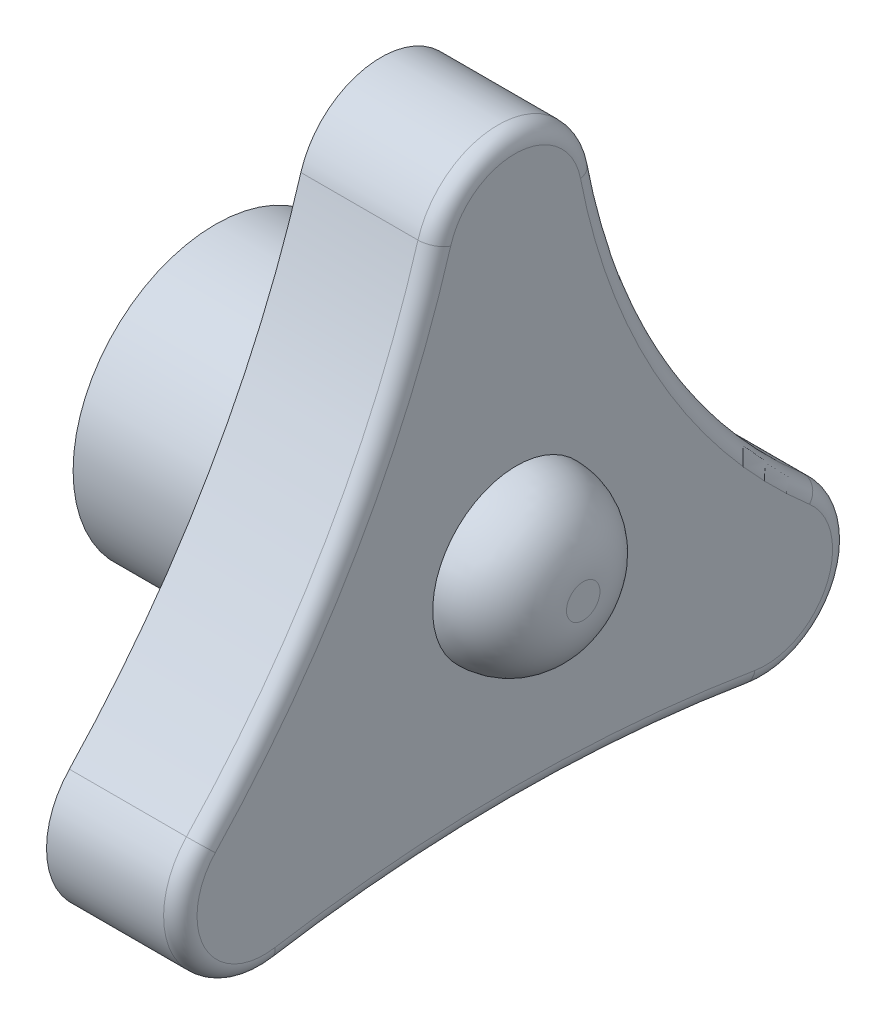
from build123d import *

# Parameters (mm, degrees)
BOSS_EXTRUDE1_DEPTH = 4
FILLET1_R           = 0.5
SHELL2_T            = -1
SKETCH2_R           = 4.25
SKETCH2_R_2         = 2.25
BOSS_EXTRUDE2_DEPTH = 8
SKETCH3_R           = 2.5
BOSS_EXTRUDE3_DEPTH = 2
FILLET2_R           = 2


with BuildPart() as part:
    # Sketch1 → Boss-Extrude1 (new body)
    with BuildSketch(Plane(origin=(0, 0, 0), x_dir=(0, 0, -1), z_dir=(1, 0, 0))):
        with BuildLine():
            ThreePointArc((2.454932738, 13.462932908), (0.124483772, 15.487279891), (-2.395757596, 13.704765785))
            ThreePointArc((-2.395757596, 13.704765785), (-5.152279099, 7.304796743), (-9.316554121, 1.717594576))
            ThreePointArc((-9.316554121, 1.717594576), (-9.70794679, -1.172591563), (-7.094283556, -2.46685917))
            ThreePointArc((-7.094283556, -2.46685917), (0, -1.887364685), (7.094283556, -2.46685917))
            ThreePointArc((7.094283556, -2.46685917), (9.763595355, -1.061195586), (9.136708277, 1.88975819))
            ThreePointArc((9.136708277, 1.88975819), (4.822059624, 7.114144441), (2.454932738, 13.462932908))
        make_face()
    extrude(amount=BOSS_EXTRUDE1_DEPTH)

    # Fillet1
    fillet1_edges = [part.edges().sort_by_distance(p)[0] for p in [
        (4, -1.887364685, 0),
        (4, -1.061195586, -9.763595355),
        (4, 7.114144441, -4.822059624),
        (4, 15.487279891, -0.124483772),
        (4, 7.304796743, 5.152279099),
        (4, -1.172591563, 9.70794679),
    ]]
    fillet(fillet1_edges, radius=FILLET1_R)

    # Shell2
    shell2_openings = [part.faces().sort_by_distance(p)[0] for p in [
        (0, 4.2016107, 0.088845764),
    ]]
    offset(amount=SHELL2_T, openings=shell2_openings, kind=Kind.INTERSECTION)

    # Sketch2 → Boss-Extrude2 (add)
    with BuildSketch(Plane.ZY.offset(-3)):
        with Locations(Location((-0.044973033, 4.389682089, 0), (0, 0, 180))):
            Circle(SKETCH2_R)
        with Locations((-0.044973033, 4.389682089)):
            Circle(SKETCH2_R_2, mode=Mode.SUBTRACT)
    extrude(amount=BOSS_EXTRUDE2_DEPTH)

    # Sketch3 → Boss-Extrude3 (add)
    with BuildSketch(Plane(origin=(4, 0, 0), x_dir=(0, 0, -1), z_dir=(1, 0, 0))):
        with Locations((0.044973661, 4.389769746)):
            Circle(SKETCH3_R)
    extrude(amount=BOSS_EXTRUDE3_DEPTH)

    # Fillet2
    fillet2_edges = [part.edges().sort_by_distance(p)[0] for p in [
        (6, 4.389769746, 2.455026339),
    ]]
    fillet(fillet2_edges, radius=FILLET2_R - 0.0001)  # a hair under: the kernel refuses the full size


solid = part.part
